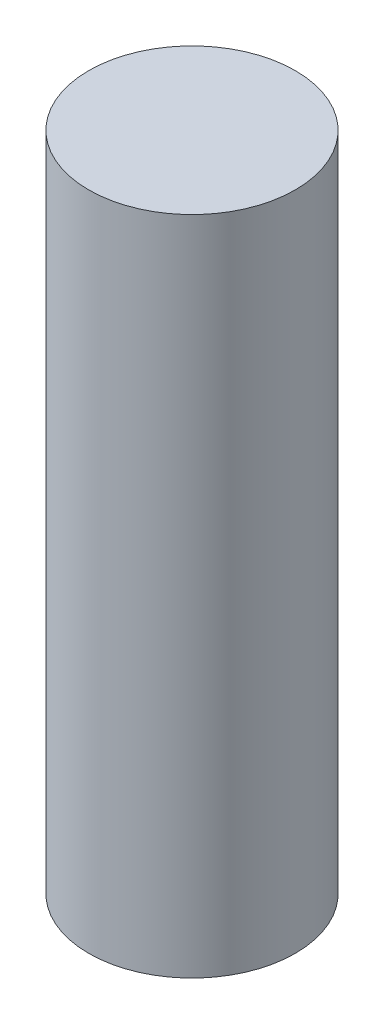
from build123d import *

# Parameters (mm, degrees)
SKETCH1_R           = 12.5
BOSS_EXTRUDE1_DEPTH = 80


with BuildPart() as part:
    # Sketch1 → Boss-Extrude1 (new body)
    with BuildSketch(Plane(origin=(0, 0, 0), x_dir=(1, 0, 0), z_dir=(0, 1, 0))):
        Circle(SKETCH1_R)
    extrude(amount=BOSS_EXTRUDE1_DEPTH)


solid = part.part
